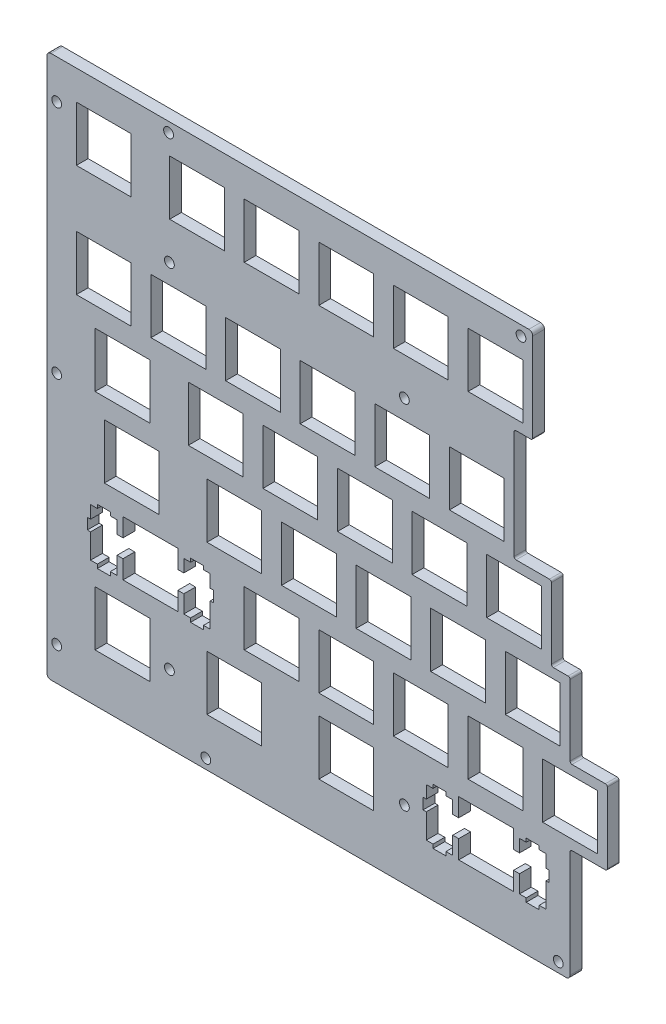
from build123d import *

# Parameters (mm, degrees)
MODEL_W                = 13.99954
MODEL_H                = 13.99946
MODEL_W_2              = 13.9993
MODEL_H_2              = 13.9994
MODEL_W_3              = 14
MODEL_W_4              = 14.00087
MODEL_H_3              = 13.9993
MODEL_W_5              = 13.9998
MODEL_W_6              = 13.999
MODEL_W_7              = 13.99955
MODEL_W_8              = 14.0007
MODEL_H_4              = 13.999
EXTRUDE_1_DEPTH        = 3
SKETCH_5_W             = 128.5879154
SKETCH_5_H             = 3
EXTRUDE_3_DEPTH        = 4.76
EXTRUDE_2_DEPTH        = 3
SKETCH_3_R             = 1.25
CUT_EXTRUDE_1_DEPTH    = 3
PATTERN_LINEAR_1_COUNT = 2
PATTERN_LINEAR_1_PITCH = 90
SKETCH_4_R             = 1.25
CUT_EXTRUDE_2_DEPTH    = 3
PATTERN_LINEAR_2_COUNT = 3
PATTERN_LINEAR_2_PITCH = 60
FILLET_1_R             = 1
FILLET_2_R             = 0.5
SKETCH_6_R             = 1.25
CUT_EXTRUDE_3_DEPTH    = 10


with BuildPart() as part:
    # Model → 凸台-拉伸1 (new body)
    with BuildSketch(Plane.XY):
        Polygon((0.0950846, 124.083), (119.158, 124.083), (119.158, 105.033), (114.395, 105.033), (114.395, 76.453), (123.92, 76.453), (123.92, 57.403), (128.683, 57.403), (128.683, 38.353), (138.208, 38.353), (138.208, 19.303), (128.683, 19.303), (128.683, 0.257693), (0.0950846, 0.257693), align=None)
        Polygon((100.251, 16.7831), (100.251, 12.0826), (98.7256, 12.0826), (98.7256, 15.3128), (97.0001, 15.3128), (97.0001, 16.2333), (93.701, 16.2333), (93.701, 15.3128), (91.9759, 15.3128), (91.9759, 12.0826), (91.1504, 12.0826), (91.1504, 9.28384), (91.9759, 9.28384), (91.9759, 3.01377), (93.701, 3.01377), (93.701, 2.03261), (97.0001, 2.03261), (97.0001, 3.01377), (98.7256, 3.01377), (98.7256, 7.48273), (100.251, 7.48273), (100.251, 2.78364), (114.25, 2.78364), (114.25, 7.48273), (115.776, 7.48273), (115.776, 3.01377), (117.5, 3.01377), (117.5, 2.03261), (120.8, 2.03261), (120.8, 3.01377), (122.525, 3.01377), (122.525, 9.28384), (123.351, 9.28384), (123.351, 12.0826), (122.525, 12.0826), (122.525, 15.3128), (120.8, 15.3128), (120.8, 16.2333), (117.5, 16.2333), (117.5, 15.3128), (115.776, 15.3128), (115.776, 12.0826), (114.25, 12.0826), (114.25, 16.7831), align=None, mode=Mode.SUBTRACT)
        with Locations((14.38193, 9.78337)):
            Rectangle(MODEL_W, MODEL_H, mode=Mode.SUBTRACT)
        with Locations((42.95685, 9.78337)):
            Rectangle(MODEL_W_2, MODEL_H, mode=Mode.SUBTRACT)
        with Locations((71.53185, 9.78337)):
            Rectangle(MODEL_W_2, MODEL_H, mode=Mode.SUBTRACT)
        Polygon((14.5259, 35.833), (14.5259, 31.1326), (13.0004, 31.1326), (13.0004, 34.3628), (11.2751, 34.3628), (11.2751, 35.2834), (7.97609, 35.2834), (7.97609, 34.3628), (6.2508, 34.3628), (6.2508, 31.1326), (5.42533, 31.1326), (5.42533, 28.3338), (6.2508, 28.3338), (6.2508, 22.0638), (7.97609, 22.0638), (7.97609, 21.0826), (11.2751, 21.0826), (11.2751, 22.0638), (13.0004, 22.0638), (13.0004, 26.5327), (14.5259, 26.5327), (14.5259, 21.8336), (28.5254, 21.8336), (28.5254, 26.5327), (30.0509, 26.5327), (30.0509, 22.0638), (31.7748, 22.0638), (31.7748, 21.0826), (35.0752, 21.0826), (35.0752, 22.0638), (36.8004, 22.0638), (36.8004, 28.3338), (37.6259, 28.3338), (37.6259, 31.1326), (36.8004, 31.1326), (36.8004, 34.3628), (35.0752, 34.3628), (35.0752, 35.2834), (31.7748, 35.2834), (31.7748, 34.3628), (30.0509, 34.3628), (30.0509, 31.1326), (28.5254, 31.1326), (28.5254, 35.833), align=None, mode=Mode.SUBTRACT)
        with Locations((52.48185, 28.8333)):
            Rectangle(MODEL_W_2, MODEL_H_2, mode=Mode.SUBTRACT)
        with Locations((71.53185, 28.8333)):
            Rectangle(MODEL_W_2, MODEL_H_2, mode=Mode.SUBTRACT)
        with Locations((90.58185, 28.8333)):
            Rectangle(MODEL_W_2, MODEL_H_2, mode=Mode.SUBTRACT)
        with Locations((109.632, 28.8333)):
            Rectangle(MODEL_W_3, MODEL_H_2, mode=Mode.SUBTRACT)
        with Locations((128.682, 28.8333)):
            Rectangle(MODEL_W_3, MODEL_H_2, mode=Mode.SUBTRACT)
        with Locations((16.762465, 47.88345)):
            Rectangle(MODEL_W_4, MODEL_H_3, mode=Mode.SUBTRACT)
        with Locations((42.95685, 47.88345)):
            Rectangle(MODEL_W_2, MODEL_H_3, mode=Mode.SUBTRACT)
        with Locations((62.00685, 47.88345)):
            Rectangle(MODEL_W_2, MODEL_H_3, mode=Mode.SUBTRACT)
        with Locations((81.05685, 47.88345)):
            Rectangle(MODEL_W_2, MODEL_H_3, mode=Mode.SUBTRACT)
        with Locations((100.1071, 47.88345)):
            Rectangle(MODEL_W_5, MODEL_H_3, mode=Mode.SUBTRACT)
        with Locations((119.157, 47.88345)):
            Rectangle(MODEL_W_3, MODEL_H_3, mode=Mode.SUBTRACT)
        with Locations((14.38193, 66.93345)):
            Rectangle(MODEL_W, MODEL_H_3, mode=Mode.SUBTRACT)
        with Locations((38.19435, 66.93345)):
            Rectangle(MODEL_W_2, MODEL_H_3, mode=Mode.SUBTRACT)
        with Locations((57.24435, 66.93345)):
            Rectangle(MODEL_W_2, MODEL_H_3, mode=Mode.SUBTRACT)
        with Locations((76.29435, 66.93345)):
            Rectangle(MODEL_W_2, MODEL_H_3, mode=Mode.SUBTRACT)
        with Locations((95.34435, 66.93345)):
            Rectangle(MODEL_W_2, MODEL_H_3, mode=Mode.SUBTRACT)
        with Locations((114.3945, 66.93345)):
            Rectangle(MODEL_W_6, MODEL_H_3, mode=Mode.SUBTRACT)
        with Locations((9.619425, 85.98345)):
            Rectangle(MODEL_W_7, MODEL_H_3, mode=Mode.SUBTRACT)
        with Locations((28.66935, 85.98345)):
            Rectangle(MODEL_W_2, MODEL_H_3, mode=Mode.SUBTRACT)
        with Locations((47.71935, 85.98345)):
            Rectangle(MODEL_W_2, MODEL_H_3, mode=Mode.SUBTRACT)
        with Locations((66.76935, 85.98345)):
            Rectangle(MODEL_W_2, MODEL_H_3, mode=Mode.SUBTRACT)
        with Locations((85.81935, 85.98345)):
            Rectangle(MODEL_W_2, MODEL_H_3, mode=Mode.SUBTRACT)
        with Locations((104.86865, 85.98345)):
            Rectangle(MODEL_W_8, MODEL_H_3, mode=Mode.SUBTRACT)
        with Locations((9.619425, 114.5585)):
            Rectangle(MODEL_W_7, MODEL_H_4, mode=Mode.SUBTRACT)
        with Locations((33.43185, 114.5585)):
            Rectangle(MODEL_W_2, MODEL_H_4, mode=Mode.SUBTRACT)
        with Locations((52.48185, 114.5585)):
            Rectangle(MODEL_W_2, MODEL_H_4, mode=Mode.SUBTRACT)
        with Locations((71.53185, 114.5585)):
            Rectangle(MODEL_W_2, MODEL_H_4, mode=Mode.SUBTRACT)
        with Locations((90.58185, 114.5585)):
            Rectangle(MODEL_W_2, MODEL_H_4, mode=Mode.SUBTRACT)
        with Locations((109.632, 114.5585)):
            Rectangle(MODEL_W_3, MODEL_H_4, mode=Mode.SUBTRACT)
    extrude(amount=EXTRUDE_1_DEPTH)

    # 草图5 → 凸台-拉伸3 (add)
    with BuildSketch(Plane.XZ.offset(-0.257693)):
        with Locations((64.3890423, 1.5)):
            Rectangle(SKETCH_5_W, SKETCH_5_H)
    extrude(amount=EXTRUDE_3_DEPTH)

    # 草图2 → 凸台-拉伸2 (add)
    with BuildSketch(Plane.XY.offset(3)):
        Polygon((119.158, 124.083), (0.0950846, 124.083), (0.0950846, -4.502307), (128.683, -4.502307), (128.683, -9.502307), (-4.9049154, -9.502307), (-4.9049154, 129.083), (119.158, 129.083), align=None)
    extrude(amount=-EXTRUDE_2_DEPTH)

    # 草图3 → 切除-拉伸1 (cut)
    with BuildSketch(Plane.XY.offset(3)):
        with Locations((125.683, -7.002307)):
            Circle(SKETCH_3_R)
        with Locations((116.158, 126.583)):
            Circle(SKETCH_3_R)
    cut_extrude_1 = extrude(amount=-CUT_EXTRUDE_1_DEPTH, mode=Mode.SUBTRACT)

    # 阵列(线性)1: 切除-拉伸1 ×2
    with Locations(*[(-i * PATTERN_LINEAR_1_PITCH, 0, 0) for i in range(1, PATTERN_LINEAR_1_COUNT)]):
        add(cut_extrude_1, mode=Mode.SUBTRACT)

    # 草图4 → 切除-拉伸2 (cut)
    with BuildSketch(Plane.XY.offset(3)):
        with Locations((-2.4049154, 119.083)):
            Circle(SKETCH_4_R)
    cut_extrude_2 = extrude(amount=-CUT_EXTRUDE_2_DEPTH, mode=Mode.SUBTRACT)

    # 阵列(线性)2: 切除-拉伸2 ×3
    with Locations(*[(0, -i * PATTERN_LINEAR_2_PITCH, 0) for i in range(1, PATTERN_LINEAR_2_COUNT)]):
        add(cut_extrude_2, mode=Mode.SUBTRACT)

    # 圆角1
    fillet_1_edges = [part.edges().sort_by_distance(p)[0] for p in [
        (-4.9049154, -9.502307, 1.5),
        (128.683, -9.502307, 1.5),
        (119.158, 129.083, 1.5),
        (-4.9049154, 129.083, 1.5),
    ]]
    fillet(fillet_1_edges, radius=FILLET_1_R)

    # 圆角2
    fillet_2_edges = [part.edges().sort_by_distance(p)[0] for p in [
        (119.158, 105.033, 1.5),
        (114.395, 105.033, 1.5),
        (123.92, 76.453, 1.5),
        (114.395, 76.453, 1.5),
        (128.683, 57.403, 1.5),
        (123.92, 57.403, 1.5),
        (138.208, 38.353, 1.5),
        (128.683, 38.353, 1.5),
        (138.208, 19.303, 1.5),
        (128.683, 19.303, 1.5),
    ]]
    fillet(fillet_2_edges, radius=FILLET_2_R)

    # 草图6 → 切除-拉伸3 (cut)
    with BuildSketch(Plane.XY.offset(3)):
        with Locations((26.3817, 7.9831)):
            Circle(SKETCH_6_R)
        with Locations((86.3817, 7.9831)):
            Circle(SKETCH_6_R)
        with Locations((86.3817, 97.9831)):
            Circle(SKETCH_6_R)
        with Locations((26.3817, 97.9831)):
            Circle(SKETCH_6_R)
    extrude(amount=-CUT_EXTRUDE_3_DEPTH, mode=Mode.SUBTRACT)


solid = part.part
